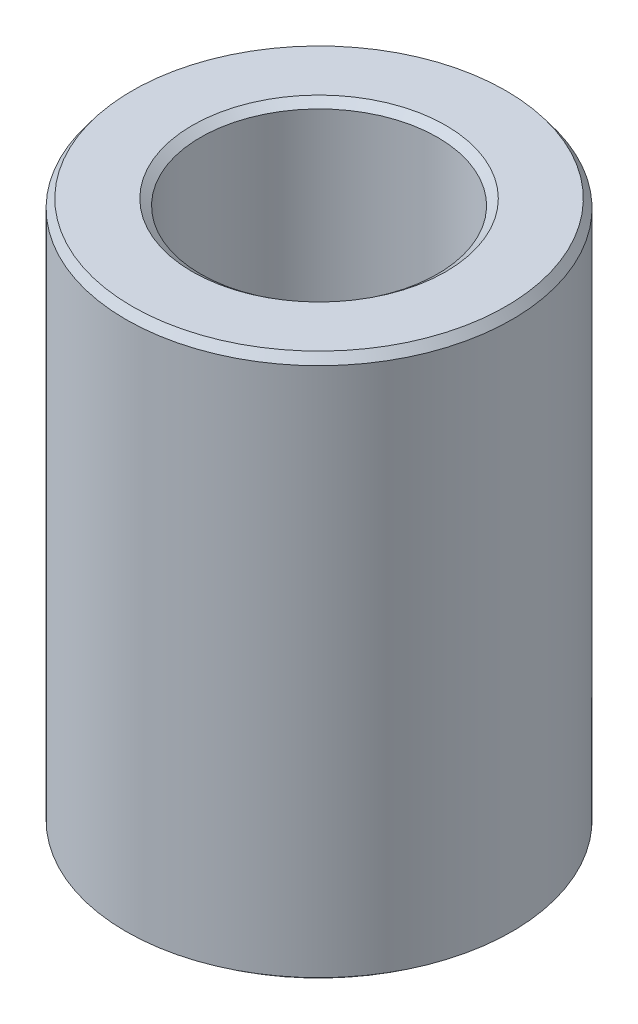
from build123d import *
from OCP.BRepFilletAPI import BRepFilletAPI_MakeChamfer

# Parameters (mm, degrees)
SKETCH1_R           = 20
BOSS_EXTRUDE1_DEPTH = 56.410921503
SKETCH2_R           = 12.27567597
CUT_EXTRUDE1_DEPTH  = 64.104612073
CHAMFER1_SIZE       = 0.858762188
CHAMFER1_SIZE2      = 0.638685782


with BuildPart() as part:
    # Sketch1 → Boss-Extrude1 (new body)
    with BuildSketch(Plane(origin=(0, 0, 0), x_dir=(1, 0, 0), z_dir=(0, 1, 0))):
        Circle(SKETCH1_R)
    extrude(amount=BOSS_EXTRUDE1_DEPTH)

    # Sketch2 → Cut-Extrude1 (cut, through all)
    with BuildSketch(Plane(origin=(0, 0, 0), x_dir=(1, 0, 0), z_dir=(0, 1, 0))):
        Circle(SKETCH2_R)
    extrude(amount=CUT_EXTRUDE1_DEPTH, mode=Mode.SUBTRACT)

    # Chamfer1: one chamfer whose edges measure the first distance from different faces: ONE call of the kernel's chamfer builder (chamfer() names one face for all edges)
    chamfer1_edges_1 = [part.edges().sort_by_distance(p)[0] for p in [
        (-12.27567597, 56.410921503, 0),
    ]]
    chamfer1_side_1 = [part.faces().sort_by_distance(p)[0] for p in [
        (-19.434314575, 56.410921503, 0),
    ]]
    chamfer1_edges_2 = [part.edges().sort_by_distance(p)[0] for p in [
        (-12.27567597, 0, 0),
    ]]
    chamfer1_side_2 = [part.faces().sort_by_distance(p)[0] for p in [
        (-12.27567597, 28.205460752, 0),
    ]]
    chamfer1_edges_3 = [part.edges().sort_by_distance(p)[0] for p in [
        (-20, 0, 0),
    ]]
    chamfer1_side_3 = [part.faces().sort_by_distance(p)[0] for p in [
        (-19.434314575, 0, 0),
    ]]
    chamfer1_edges_4 = [part.edges().sort_by_distance(p)[0] for p in [
        (-20, 56.410921503, 0),
    ]]
    chamfer1_side_4 = [part.faces().sort_by_distance(p)[0] for p in [
        (-20, 28.205460752, 0),
    ]]
    chamfer1 = BRepFilletAPI_MakeChamfer(part.part.solid().wrapped)
    for e in chamfer1_edges_1:
        chamfer1.Add(CHAMFER1_SIZE, CHAMFER1_SIZE2, e.wrapped, chamfer1_side_1[0].wrapped)  # the first distance lies on this face
    for e in chamfer1_edges_2:
        chamfer1.Add(CHAMFER1_SIZE, CHAMFER1_SIZE2, e.wrapped, chamfer1_side_2[0].wrapped)  # the first distance lies on this face
    for e in chamfer1_edges_3:
        chamfer1.Add(CHAMFER1_SIZE, CHAMFER1_SIZE2, e.wrapped, chamfer1_side_3[0].wrapped)  # the first distance lies on this face
    for e in chamfer1_edges_4:
        chamfer1.Add(CHAMFER1_SIZE, CHAMFER1_SIZE2, e.wrapped, chamfer1_side_4[0].wrapped)  # the first distance lies on this face
    add(Compound.cast(chamfer1.Shape()), mode=Mode.REPLACE)


solid = part.part
